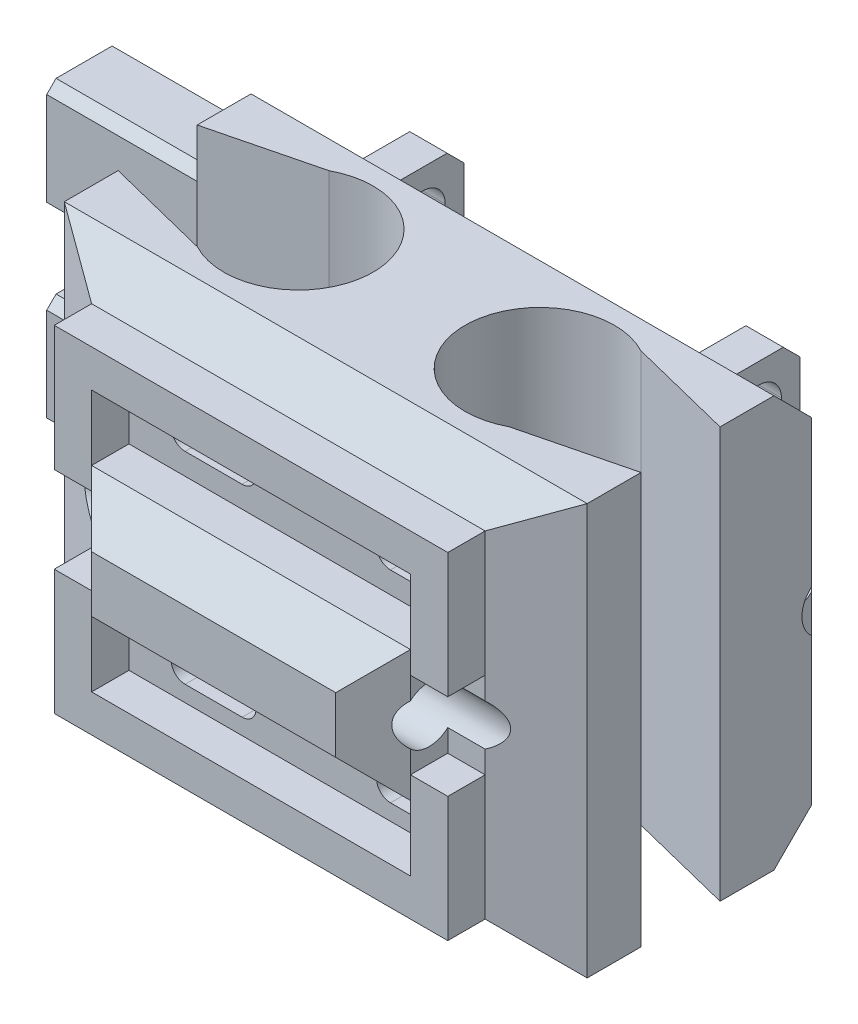
from build123d import *
from OCP.BRepFilletAPI import BRepFilletAPI_MakeChamfer

# Parameters (mm, degrees)
BASE_W                           = 14
BASE_H                           = 11
PHALANGE_SHAPE_DEPTH             = 7
CHAMFER4_SIZE                    = 1
CHAMFER5_SIZE                    = 1
CHAMFER5_SIZE2                   = 1.732050808
CHAMFER6_SIZE                    = 1
SKETCH8_W                        = 8.535898384
SKETCH8_H                        = 3.5
LIGAMENT_INSIDE_DEPTH            = 2
LIGAMENT_INSIDE_HOLE_DEPTH       = 4.254422658
LIGAMENT_INSIDE_HOLE_DEPTH_BACK  = 34.5
SKETCH9_R                        = 0.75
CHAMFER9_SIZE                    = 1
SKETCH10_W                       = 12
SKETCH10_H                       = 3.5
LIGAMENT_OUTSIDE_DEPTH           = 2
LIGAMENT_OUTSIDE_HOLE_DEPTH      = 2.5
LIGAMENT_OUTSIDE_HOLE_DEPTH_BACK = 36.5
SKETCH11_R                       = 0.75
CHAMFER11_SIZE                   = 1
TENDONS_FIXATION_DEPTH           = 11
SKETCH12_W                       = 1
SKETCH12_H                       = 3.75
BOSS_EXTRUDE7_DEPTH              = 2
TOUCH_SENSOR_WIRE_GAUGE_DEPTH    = 12
CHAMFER12_SIZE                   = 0.3
CHAMFER13_SIZE                   = 0.75
SKETCH15_W                       = 2
SKETCH15_H                       = 3
BOSS_EXTRUDE8_DEPTH              = 4.47
CHAMFER14_SIZE                   = 0.25
CHAMFER15_SIZE                   = 0.5
SKETCH16_W                       = 1
SKETCH16_H                       = 2.345491503
SKETCH16_W_2                     = 10.535898384
SKETCH16_H_2                     = 1
BOSS_EXTRUDE9_DEPTH              = 1
CUT_EXTRUDE1_DEPTH               = 1


with BuildPart() as part:
    # Base → Phalange shape (new body)
    with BuildSketch(Plane.XY):
        with Locations((7, 5.5)):
            Rectangle(BASE_W, BASE_H)
    extrude(amount=PHALANGE_SHAPE_DEPTH)

    # Chamfer4
    chamfer4_edges = [part.edges().sort_by_distance(p)[0] for p in [
        (7, 11, 7),
        (7, 0, 7),
    ]]
    chamfer(chamfer4_edges, length=CHAMFER4_SIZE)

    # Chamfer5: one chamfer whose edges measure the first distance from different faces: ONE call of the kernel's chamfer builder (chamfer() names one face for all edges)
    chamfer5_edges_1 = [part.edges().sort_by_distance(p)[0] for p in [
        (0, 5.5, 7),
    ]]
    chamfer5_side_1 = [part.faces().sort_by_distance(p)[0] for p in [
        (0, 5.5, 3.458333333),
    ]]
    chamfer5_edges_2 = [part.edges().sort_by_distance(p)[0] for p in [
        (14, 5.5, 7),
    ]]
    chamfer5_side_2 = [part.faces().sort_by_distance(p)[0] for p in [
        (14, 5.5, 3.458333333),
    ]]
    chamfer5 = BRepFilletAPI_MakeChamfer(part.part.solid().wrapped)
    for e in chamfer5_edges_1:
        chamfer5.Add(CHAMFER5_SIZE, CHAMFER5_SIZE2, e.wrapped, chamfer5_side_1[0].wrapped)  # the first distance lies on this face
    for e in chamfer5_edges_2:
        chamfer5.Add(CHAMFER5_SIZE, CHAMFER5_SIZE2, e.wrapped, chamfer5_side_2[0].wrapped)  # the first distance lies on this face
    add(Compound.cast(chamfer5.Shape()), mode=Mode.REPLACE)

    # Chamfer6
    chamfer6_edges = [part.edges().sort_by_distance(p)[0] for p in [
        (7, 11, 0),
        (7, 0, 0),
    ]]
    chamfer(chamfer6_edges, length=CHAMFER6_SIZE)

    # Sketch8 → Ligament inside (add)
    with BuildSketch(Plane.XY.offset(7)):
        with Locations((7, 5.5)):
            Rectangle(SKETCH8_W, SKETCH8_H)
    extrude(amount=LIGAMENT_INSIDE_DEPTH)

    # Sketch9 → Ligament inside hole (cut, two sides: drawn at the far end of the back side and taken through both)
    with BuildSketch(Plane(origin=(11.267949192, 0, 0), x_dir=(0, 0, -1), z_dir=(1, 0, 0)).offset(-LIGAMENT_INSIDE_HOLE_DEPTH_BACK)):
        with Locations(Location((-7.5, 5.5, 0), (0, 0, 311.810314896))):
            Circle(SKETCH9_R)
    extrude(amount=LIGAMENT_INSIDE_HOLE_DEPTH + LIGAMENT_INSIDE_HOLE_DEPTH_BACK, mode=Mode.SUBTRACT)

    # Chamfer9
    # the kernel refuses this chamfer: 1 mm, written as the material it takes off along each edge
    with BuildSketch(Plane(origin=(13.83963218, 3.75, 9), x_dir=(0, -0.027495876610586487, -0.9996219169112968), z_dir=(-1, 0, 0)), Plane(origin=(0.16036782, 7.25, 9), x_dir=(0, 0.027495876610586487, -0.9996219169112968), z_dir=(1, 0, 0))) as chamfer9_piece_1:
        Polygon((CHAMFER9_SIZE * 0.999621916911, -CHAMFER9_SIZE * 0.0274958766106), (-CHAMFER9_SIZE * 0.0274958766106, -CHAMFER9_SIZE * 0.999621916911), (0, 0), align=None)
    extrude(amount=13.679264361, mode=Mode.SUBTRACT)
    with BuildSketch(Plane(origin=(11.267949192, 9.821682988, 9), x_dir=(0.027495876610585623, 0, -0.9996219169112968), z_dir=(0, -1, 0)), Plane(origin=(2.732050808, 1.178317012, 9), x_dir=(-0.027495876610586487, 0, -0.9996219169112968), z_dir=(0, 1, 0))) as chamfer9_piece_2:
        Polygon((CHAMFER9_SIZE * 0.999621916911, -CHAMFER9_SIZE * 0.0274958766106), (-CHAMFER9_SIZE * 0.0274958766106, -CHAMFER9_SIZE * 0.999621916911), (0, 0), align=None)
    extrude(amount=8.643365976, mode=Mode.SUBTRACT)

    # Sketch10 → Ligament outside (add)
    with BuildSketch(Plane(origin=(0, 0, 0), x_dir=(-1, 0, 0), z_dir=(0, 0, -1))):
        with Locations((-7, 5.5)):
            Rectangle(SKETCH10_W, SKETCH10_H)
    extrude(amount=LIGAMENT_OUTSIDE_DEPTH)

    # Sketch11 → Ligament outside hole (cut, two sides: drawn at the far end of the back side and taken through both)
    with BuildSketch(Plane.ZY.offset(-1).offset(-LIGAMENT_OUTSIDE_HOLE_DEPTH_BACK)):
        with Locations(Location((-0.5, 5.5, 0), (0, 0, 48.189685104))):
            Circle(SKETCH11_R)
    extrude(amount=LIGAMENT_OUTSIDE_HOLE_DEPTH + LIGAMENT_OUTSIDE_HOLE_DEPTH_BACK, mode=Mode.SUBTRACT)

    # Chamfer11
    # the kernel refuses this chamfer: 1 mm, written as the material it takes off along each edge
    with BuildSketch(Plane(origin=(13, 9.821682988, -2), x_dir=(0.027495876610585623, 0, 0.9996219169112968), z_dir=(0, -1, 0)), Plane(origin=(1, 1.178317012, -2), x_dir=(-0.02749587661058638, 0, 0.9996219169112968), z_dir=(0, 1, 0))) as chamfer11_piece_1:
        Polygon((CHAMFER11_SIZE * 0.999621916911, CHAMFER11_SIZE * 0.0274958766106), (-CHAMFER11_SIZE * 0.0274958766106, CHAMFER11_SIZE * 0.999621916911), (0, 0), align=None)
    extrude(amount=8.643365976, mode=Mode.SUBTRACT)
    with BuildSketch(Plane(origin=(15.571682988, 3.75, -2), x_dir=(0, -0.027495876610586487, 0.9996219169112968), z_dir=(-1, 0, 0)), Plane(origin=(-1.571682988, 7.25, -2), x_dir=(0, 0.027495876610586487, 0.9996219169112968), z_dir=(1, 0, 0))) as chamfer11_piece_2:
        Polygon((CHAMFER11_SIZE * 0.999621916911, CHAMFER11_SIZE * 0.0274958766106), (-CHAMFER11_SIZE * 0.0274958766106, CHAMFER11_SIZE * 0.999621916911), (0, 0), align=None)
    extrude(amount=17.143365976, mode=Mode.SUBTRACT)

    # Tendon extrude → Tendons fixation (cut)
    with BuildSketch(Plane.XZ):
        with BuildLine():
            Line((2.828823529, 5.264705882), (0, 4.5575))
            Line((0, 4.5575), (0, 2.4425))
            Line((0, 2.4425), (2.828823529, 1.735294118))
            ThreePointArc((2.828823529, 1.735294118), (5.77, 3.5), (2.828823529, 5.264705882))
        make_face()
        with BuildLine():
            Line((11.171176471, 1.735294118), (14, 2.4425))
            Line((14, 2.4425), (14, 4.5575))
            Line((14, 4.5575), (11.171176471, 5.264705882))
            ThreePointArc((11.171176471, 5.264705882), (8.23, 3.5), (11.171176471, 1.735294118))
        make_face()
    extrude(amount=-TENDONS_FIXATION_DEPTH, mode=Mode.SUBTRACT)

    # Sketch12 → Boss-Extrude7 (add)
    with BuildSketch(Plane(origin=(0, 0, 0), x_dir=(-1, 0, 0), z_dir=(0, 0, -1))):
        with Locations((-2.5, 8.125)):
            Rectangle(SKETCH12_W, SKETCH12_H)
        with Locations((-2.5, 2.875)):
            Rectangle(SKETCH12_W, SKETCH12_H)
        with Locations((-11.5, 2.875)):
            Rectangle(SKETCH12_W, SKETCH12_H)
        with Locations((-11.5, 8.125)):
            Rectangle(SKETCH12_W, SKETCH12_H)
    extrude(amount=BOSS_EXTRUDE7_DEPTH)

    # Sketch13 → Touch sensor wire gauge (cut)
    with BuildSketch(Plane.ZY.offset(-2)):
        with BuildLine():
            Line((0, 8.85), (0, 7.85))
            ThreePointArc((0, 7.85), (-0.6, 7.25), (-1.2, 7.85))
            Line((-1.2, 7.85), (-1.2, 8.85))
            ThreePointArc((-1.2, 8.85), (-0.6, 9.45), (0, 8.85))
        make_face()
        with BuildLine():
            Line((0, 3.15), (0, 2.15))
            ThreePointArc((0, 2.15), (-0.6, 1.55), (-1.2, 2.15))
            Line((-1.2, 2.15), (-1.2, 3.15))
            ThreePointArc((-1.2, 3.15), (-0.6, 3.75), (0, 3.15))
        make_face()
    extrude(amount=-TOUCH_SENSOR_WIRE_GAUGE_DEPTH, mode=Mode.SUBTRACT)

    # Chamfer12
    # the kernel refuses this chamfer: 0.3 mm, written as the material it takes off along each edge
    with BuildSketch(Plane(origin=(2, 6.25, -2), x_dir=(-0.027495876610586622, 0, 0.9996219169112968), z_dir=(0, 1, 0))) as chamfer12_piece_1_section:
        Polygon((CHAMFER12_SIZE * 0.999621916911, CHAMFER12_SIZE * 0.0274958766106), (-CHAMFER12_SIZE * 0.0274958766106, CHAMFER12_SIZE * 0.999621916911), (0, 0), align=None)
    chamfer12_piece_1 = extrude(amount=4.521504896, mode=Mode.PRIVATE)
    chamfer12_piece_1 = split(chamfer12_piece_1, bisect_by=Plane(origin=(2.100684932, 7.261472603, -0.988527397), z_dir=(0, 0.7071067811862649, -0.7071067811868302)), keep=Keep.TOP, mode=Mode.PRIVATE)
    add(chamfer12_piece_1, mode=Mode.SUBTRACT)
    with BuildSketch(Plane(origin=(3, 10.771504896, -2), x_dir=(0.027495876610585904, 0, 0.9996219169112968), z_dir=(0, -1, 0))) as chamfer12_piece_2_section:
        Polygon((CHAMFER12_SIZE * 0.999621916911, CHAMFER12_SIZE * 0.0274958766106), (-CHAMFER12_SIZE * 0.0274958766106, CHAMFER12_SIZE * 0.999621916911), (0, 0), align=None)
    chamfer12_piece_2 = extrude(amount=5.293009793, mode=Mode.PRIVATE)
    chamfer12_piece_2 = split(chamfer12_piece_2, bisect_by=Plane(origin=(2.899315068, 7.261472603, -0.988527397), z_dir=(0, 0.7071067811862649, -0.7071067811868302)), keep=Keep.TOP, mode=Mode.PRIVATE)
    add(chamfer12_piece_2, mode=Mode.SUBTRACT)
    with BuildSketch(Plane(origin=(2, 0.228495104, -2), x_dir=(-0.027495876610586622, 0, 0.9996219169112968), z_dir=(0, 1, 0))) as chamfer12_piece_3_section:
        Polygon((CHAMFER12_SIZE * 0.999621916911, CHAMFER12_SIZE * 0.0274958766106), (-CHAMFER12_SIZE * 0.0274958766106, CHAMFER12_SIZE * 0.999621916911), (0, 0), align=None)
    chamfer12_piece_3 = extrude(amount=4.521504896, mode=Mode.PRIVATE)
    chamfer12_piece_3 = split(chamfer12_piece_3, bisect_by=Plane(origin=(2.100684932, 3.738527397, -0.988527397), z_dir=(0, -0.7071067811862649, -0.7071067811868302)), keep=Keep.TOP, mode=Mode.PRIVATE)
    add(chamfer12_piece_3, mode=Mode.SUBTRACT)
    with BuildSketch(Plane(origin=(3, 5.521504896, -2), x_dir=(0.027495876610585904, 0, 0.9996219169112968), z_dir=(0, -1, 0))) as chamfer12_piece_4_section:
        Polygon((CHAMFER12_SIZE * 0.999621916911, CHAMFER12_SIZE * 0.0274958766106), (-CHAMFER12_SIZE * 0.0274958766106, CHAMFER12_SIZE * 0.999621916911), (0, 0), align=None)
    chamfer12_piece_4 = extrude(amount=5.293009793, mode=Mode.PRIVATE)
    chamfer12_piece_4 = split(chamfer12_piece_4, bisect_by=Plane(origin=(2.899315068, 3.738527397, -0.988527397), z_dir=(0, -0.7071067811862649, -0.7071067811868302)), keep=Keep.TOP, mode=Mode.PRIVATE)
    add(chamfer12_piece_4, mode=Mode.SUBTRACT)
    with BuildSketch(Plane(origin=(12, 4.75, -2), x_dir=(0.027495876610584464, 0, 0.9996219169112968), z_dir=(0, -1, 0))) as chamfer12_piece_5_section:
        Polygon((CHAMFER12_SIZE * 0.999621916911, CHAMFER12_SIZE * 0.0274958766106), (-CHAMFER12_SIZE * 0.0274958766106, CHAMFER12_SIZE * 0.999621916911), (0, 0), align=None)
    chamfer12_piece_5 = extrude(amount=4.521504896, mode=Mode.PRIVATE)
    chamfer12_piece_5 = split(chamfer12_piece_5, bisect_by=Plane(origin=(11.899315068, 3.738527397, -0.988527397), z_dir=(0, -0.7071067811862649, -0.7071067811868302)), keep=Keep.TOP, mode=Mode.PRIVATE)
    add(chamfer12_piece_5, mode=Mode.SUBTRACT)
    with BuildSketch(Plane(origin=(11, 0.228495104, -2), x_dir=(-0.027495876610584464, 0, 0.9996219169112968), z_dir=(0, 1, 0))) as chamfer12_piece_6_section:
        Polygon((CHAMFER12_SIZE * 0.999621916911, CHAMFER12_SIZE * 0.0274958766106), (-CHAMFER12_SIZE * 0.0274958766106, CHAMFER12_SIZE * 0.999621916911), (0, 0), align=None)
    chamfer12_piece_6 = extrude(amount=5.293009793, mode=Mode.PRIVATE)
    chamfer12_piece_6 = split(chamfer12_piece_6, bisect_by=Plane(origin=(11.100684932, 3.738527397, -0.988527397), z_dir=(0, -0.7071067811862649, -0.7071067811868302)), keep=Keep.TOP, mode=Mode.PRIVATE)
    add(chamfer12_piece_6, mode=Mode.SUBTRACT)
    with BuildSketch(Plane(origin=(12, 6.25, -2), x_dir=(0.027495876610584464, 0, 0.9996219169112968), z_dir=(0, 1, 0))) as chamfer12_piece_7_section:
        Polygon((CHAMFER12_SIZE * 0.999621916911, -CHAMFER12_SIZE * 0.0274958766106), (-CHAMFER12_SIZE * 0.0274958766106, -CHAMFER12_SIZE * 0.999621916911), (0, 0), align=None)
    chamfer12_piece_7 = extrude(amount=4.521504896, mode=Mode.PRIVATE)
    chamfer12_piece_7 = split(chamfer12_piece_7, bisect_by=Plane(origin=(11.899315068, 7.261472603, -0.988527397), z_dir=(0, 0.7071067811862649, -0.7071067811868302)), keep=Keep.TOP, mode=Mode.PRIVATE)
    add(chamfer12_piece_7, mode=Mode.SUBTRACT)
    with BuildSketch(Plane(origin=(11, 10.771504896, -2), x_dir=(0.9996219169112968, 0, -0.027495876610585904), z_dir=(0, -1, 0))) as chamfer12_piece_8_section:
        Polygon((CHAMFER12_SIZE * 0.999621916911, CHAMFER12_SIZE * 0.0274958766106), (-CHAMFER12_SIZE * 0.0274958766106, CHAMFER12_SIZE * 0.999621916911), (0, 0), align=None)
    chamfer12_piece_8 = extrude(amount=5.293009793, mode=Mode.PRIVATE)
    chamfer12_piece_8 = split(chamfer12_piece_8, bisect_by=Plane(origin=(11.100684932, 7.261472603, -0.988527397), z_dir=(0, 0.7071067811862649, -0.7071067811868302)), keep=Keep.TOP, mode=Mode.PRIVATE)
    add(chamfer12_piece_8, mode=Mode.SUBTRACT)

    # Chamfer13
    chamfer13_edges = [part.edges().sort_by_distance(p)[0] for p in [
        (11.5, 10, -2),
        (11.5, 1, -2),
        (2.5, 1, -2),
        (2.5, 10, -2),
    ]]
    chamfer(chamfer13_edges, length=CHAMFER13_SIZE)

    # Sketch15 → Boss-Extrude8 (add)
    with BuildSketch(Plane.ZY):
        with Locations((1, 8)):
            Rectangle(SKETCH15_W, SKETCH15_H)
        with Locations((1, 3)):
            Rectangle(SKETCH15_W, SKETCH15_H)
    extrude(amount=BOSS_EXTRUDE8_DEPTH)

    # Chamfer14
    chamfer14_edges = [part.edges().sort_by_distance(p)[0] for p in [
        (-2.235, 4.5, 0),
        (-2.235, 1.5, 0),
        (-2.235, 1.5, 2),
        (-2.235, 4.5, 2),
        (-2.235, 9.5, 0),
        (-2.235, 6.5, 0),
        (-2.235, 6.5, 2),
        (-2.235, 9.5, 2),
    ]]
    chamfer(chamfer14_edges, length=CHAMFER14_SIZE)

    # Chamfer15
    chamfer15_edges = [part.edges().sort_by_distance(p)[0] for p in [
        (0, 6.5, 1),
        (0, 9.5, 1),
        (0, 4.5, 1),
        (0, 1.5, 1),
    ]]
    chamfer(chamfer15_edges, length=CHAMFER15_SIZE)

    # Sketch16 → Boss-Extrude9 (add)
    with BuildSketch(Plane.XY.offset(7)):
        Polygon((1.732050808, 4.345491503), (1.732050808, 2), (2.732050808, 2), (2.732050808, 3.75), (2.732050808, 4.345491503), align=None)
        Polygon((1.732050808, 2), (1.732050808, 1), (12.267949192, 1), (12.267949192, 2), (11.267949192, 2), (2.732050808, 2), align=None)
        Polygon((11.267949192, 2), (12.267949192, 2), (12.267949192, 4.345491503), (11.267949192, 4.345491503), (11.267949192, 3.75), align=None)
        with Locations((11.767949192, 7.827254249)):
            Rectangle(SKETCH16_W, SKETCH16_H)
        with Locations((7, 9.5)):
            Rectangle(SKETCH16_W_2, SKETCH16_H_2)
        with Locations((2.232050808, 7.827254249)):
            Rectangle(SKETCH16_W, SKETCH16_H)
    extrude(amount=BOSS_EXTRUDE9_DEPTH)

    # Sketch17 → Cut-Extrude1 (cut)
    with BuildSketch(Plane.XY.offset(7)):
        with BuildLine():
            Line((4.234456067, 8.571603172), (5.76245347, 8.571603172))
            ThreePointArc((5.76245347, 8.571603172), (6.134056642, 8.2), (5.76245347, 7.828396828))
            Line((5.76245347, 7.828396828), (4.234456067, 7.828396828))
            ThreePointArc((4.234456067, 7.828396828), (3.862852895, 8.2), (4.234456067, 8.571603172))
        make_face()
        with BuildLine():
            Line((9.733560051, 8.571603172), (11.261557454, 8.571603172))
            ThreePointArc((11.261557454, 8.571603172), (11.633160626, 8.2), (11.261557454, 7.828396828))
            Line((11.261557454, 7.828396828), (9.733560051, 7.828396828))
            ThreePointArc((9.733560051, 7.828396828), (9.361956879, 8.2), (9.733560051, 8.571603172))
        make_face()
        with BuildLine():
            Line((4.234456067, 3.171603172), (5.76245347, 3.171603172))
            ThreePointArc((5.76245347, 3.171603172), (6.134056642, 2.8), (5.76245347, 2.428396828))
            Line((5.76245347, 2.428396828), (4.234456067, 2.428396828))
            ThreePointArc((4.234456067, 2.428396828), (3.862852895, 2.8), (4.234456067, 3.171603172))
        make_face()
        with BuildLine():
            Line((9.733560051, 3.171603172), (11.261557454, 3.171603172))
            ThreePointArc((11.261557454, 3.171603172), (11.633160626, 2.8), (11.261557454, 2.428396828))
            Line((11.261557454, 2.428396828), (9.733560051, 2.428396828))
            ThreePointArc((9.733560051, 2.428396828), (9.361956879, 2.8), (9.733560051, 3.171603172))
        make_face()
    extrude(amount=-CUT_EXTRUDE1_DEPTH, mode=Mode.SUBTRACT)


solid = part.part
